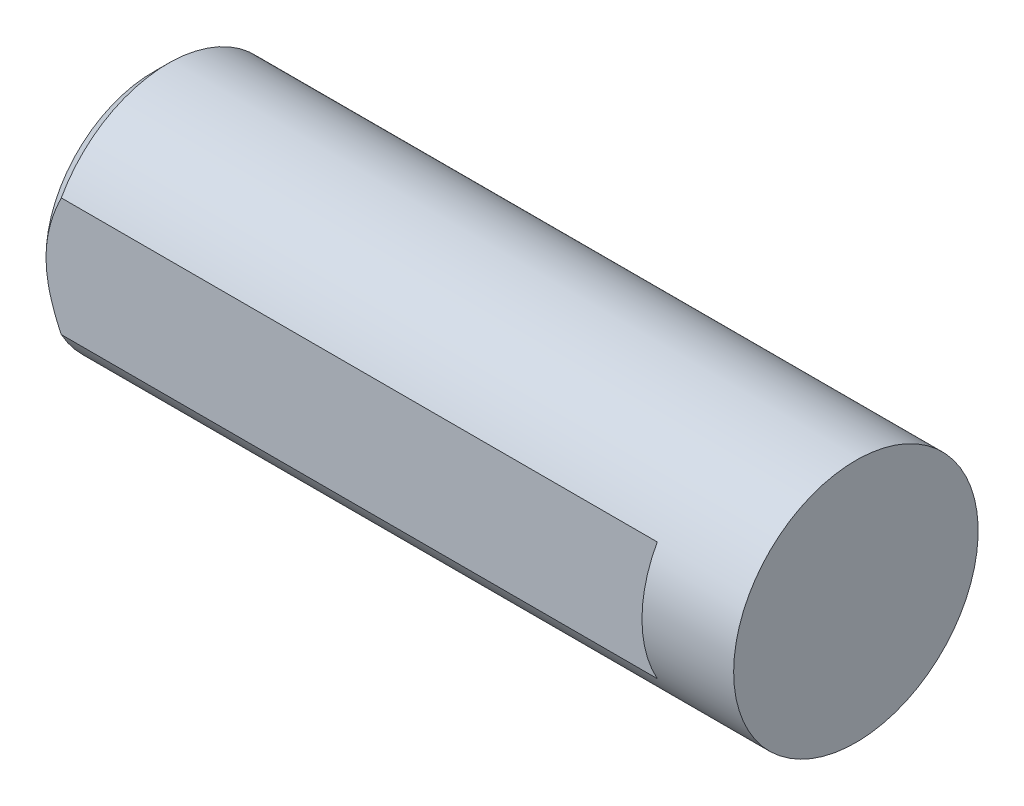
from build123d import *

# Parameters (mm, degrees)
ESQUISSE1_W             = 23
ESQUISSE1_H             = 4
ESQUISSE2_W             = 20
ESQUISSE2_H             = 10
ENL_V_MAT_EXTRU_1_DEPTH = 0.5
CHANFREIN1_SIZE         = 0.5


with BuildPart() as part:
    # Esquisse1 → Révolution1 (revolve)
    with BuildSketch(Plane.XY, mode=Mode.PRIVATE) as r_volution1_sk:
        with Locations((11.5, 2)):
            Rectangle(ESQUISSE1_W, ESQUISSE1_H)
    revolve(r_volution1_sk.sketch.rotate(Axis((-20.595505618, 0, 0), (1, 0, 0)), 90), axis=Axis((-20.595505618, 0, 0), (1, 0, 0)))

    # Esquisse2 → Enlèv. mat.-Extru.1 (cut)
    with BuildSketch(Plane.XY.offset(4)):
        with Locations((10, 0)):
            Rectangle(ESQUISSE2_W, ESQUISSE2_H)
    extrude(amount=-ENL_V_MAT_EXTRU_1_DEPTH, mode=Mode.SUBTRACT)

    # Chanfrein1
    chanfrein1_edges = [part.edges().sort_by_distance(p)[0] for p in [
        (0, 0, -4),
    ]]
    chamfer(chanfrein1_edges, length=CHANFREIN1_SIZE - 0.0001)  # a hair under: the kernel refuses the full size


solid = part.part
